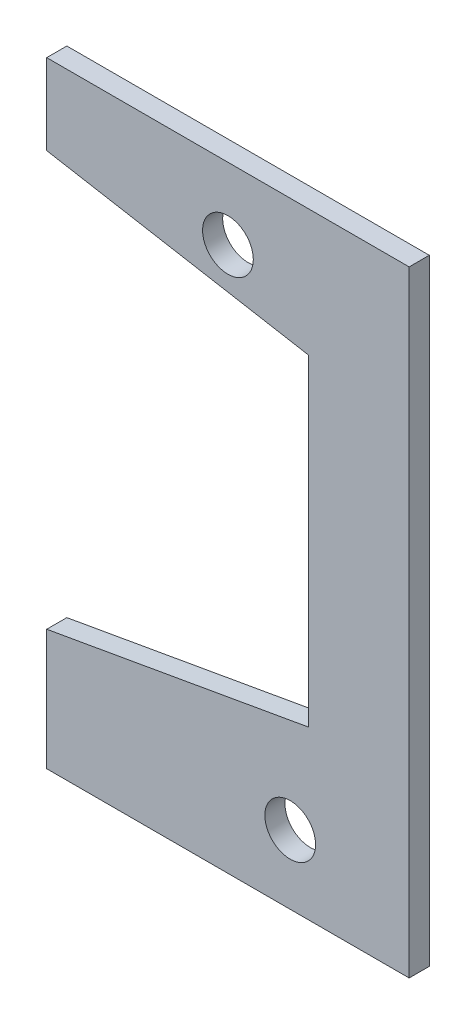
from build123d import *

# Parameters (mm, degrees)
ESQUISSE1_R        = 6.3
BOSS_EXTRU_1_DEPTH = 5


with BuildPart() as part:
    # Esquisse1 → Boss.-Extru.1 (new body)
    with BuildSketch(Plane.XY):
        Polygon((-65, 51.461253746), (0, 40), (0, -40), (-65, -51.461253746), (-65, -81.461253746), (25, -81.461253746), (25, 71.461253746), (-65, 71.461253746), align=None)
        with Locations((-20, 53.680805733)):
            Circle(ESQUISSE1_R, mode=Mode.SUBTRACT)
        with Locations((-4.533885792, -64.381013724)):
            Circle(ESQUISSE1_R, mode=Mode.SUBTRACT)
    extrude(amount=BOSS_EXTRU_1_DEPTH)


solid = part.part
